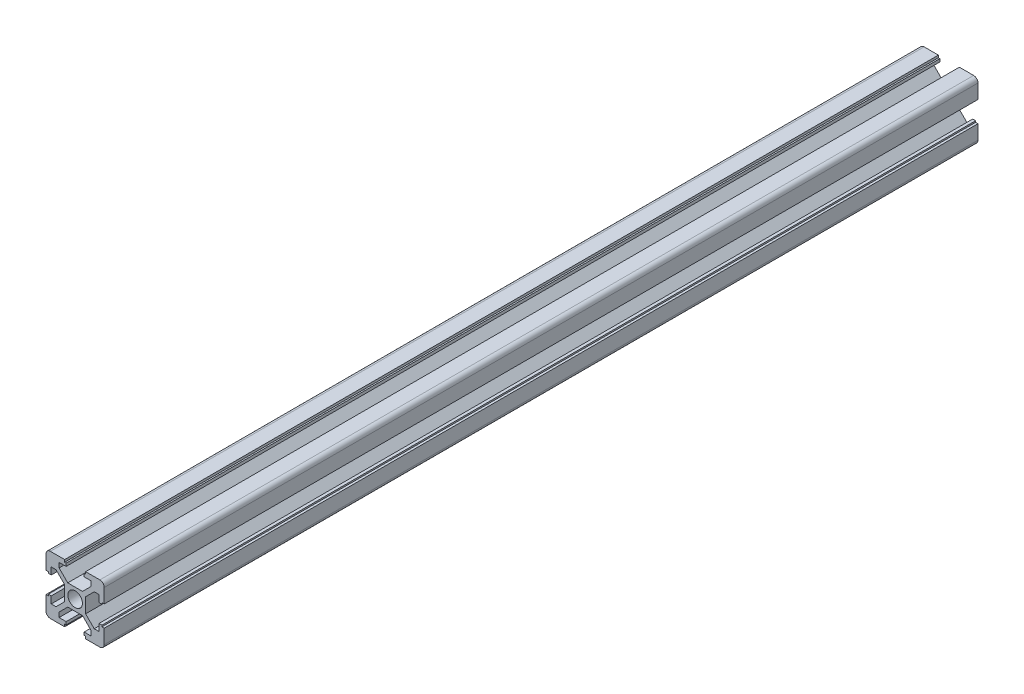
from build123d import *

# Parameters (mm, degrees)
SKETCH_1_R          = 2.5
EXTRUDE_1_DEPTH     = 300
SKETCH_2_R          = 1.75
CUT_EXTRUDE_1_DEPTH = 39


with BuildPart() as part:
    # 草图1 → 凸台-拉伸1 (new body)
    with BuildSketch(Plane.XY):
        with BuildLine():
            Line((-7.376269156, 6.834632883), (-4.415608984, 3.873972711))
            Line((-4.415608984, 3.873972711), (-4.415608984, -1.204706946))
            Line((-4.415608984, -1.204706946), (-7.376269156, -4.165367117))
            Line((-7.376269156, -4.165367117), (-9.015608984, -4.165367117))
            Line((-9.015608984, -4.165367117), (-9.015608984, -1.765367117))
            Line((-9.015608984, -1.765367117), (-10.015608984, -1.765367117))
            Line((-10.015608984, -1.765367117), (-10.015608984, -2.265367117))
            Line((-10.015608984, -2.265367117), (-10.815608984, -2.265367117))
            Line((-10.815608984, -2.265367117), (-10.815608984, -7.165367117))
            ThreePointArc((-10.815608984, -7.165367117), (-10.376269156, -8.226027289), (-9.315608984, -8.665367117))
            Line((-9.315608984, -8.665367117), (-4.415608984, -8.665367117))
            Line((-4.415608984, -8.665367117), (-4.415608984, -7.865367117))
            Line((-4.415608984, -7.865367117), (-3.915608984, -7.865367117))
            Line((-3.915608984, -7.865367117), (-3.915608984, -6.865367117))
            Line((-3.915608984, -6.865367117), (-6.315608984, -6.865367117))
            Line((-6.315608984, -6.865367117), (-6.315608984, -5.226027289))
            Line((-6.315608984, -5.226027289), (-3.354948812, -2.265367117))
            Line((-3.354948812, -2.265367117), (1.723730844, -2.265367117))
            Line((1.723730844, -2.265367117), (4.684391016, -5.226027289))
            Line((4.684391016, -5.226027289), (4.684391016, -6.865367117))
            Line((4.684391016, -6.865367117), (2.284391016, -6.865367117))
            Line((2.284391016, -6.865367117), (2.284391016, -7.865367117))
            Line((2.284391016, -7.865367117), (2.784391016, -7.865367117))
            Line((2.784391016, -7.865367117), (2.784391016, -8.665367117))
            Line((2.784391016, -8.665367117), (7.684391016, -8.665367117))
            ThreePointArc((7.684391016, -8.665367117), (8.745051188, -8.226027289), (9.184391016, -7.165367117))
            Line((9.184391016, -7.165367117), (9.184391016, -2.265367117))
            Line((9.184391016, -2.265367117), (8.384391016, -2.265367117))
            Line((8.384391016, -2.265367117), (8.384391016, -1.765367117))
            Line((8.384391016, -1.765367117), (7.384391016, -1.765367117))
            Line((7.384391016, -1.765367117), (7.384391016, -4.165367117))
            Line((7.384391016, -4.165367117), (5.745051188, -4.165367117))
            Line((5.745051188, -4.165367117), (2.784391016, -1.204706946))
            Line((2.784391016, -1.204706946), (2.784391016, 3.873972711))
            Line((2.784391016, 3.873972711), (5.745051188, 6.834632883))
            Line((5.745051188, 6.834632883), (7.384391016, 6.834632883))
            Line((7.384391016, 6.834632883), (7.384391016, 4.434632883))
            Line((7.384391016, 4.434632883), (8.384391016, 4.434632883))
            Line((8.384391016, 4.434632883), (8.384391016, 4.934632883))
            Line((8.384391016, 4.934632883), (9.184391016, 4.934632883))
            Line((9.184391016, 4.934632883), (9.184391016, 9.834632883))
            ThreePointArc((9.184391016, 9.834632883), (8.745051188, 10.895293054), (7.684391016, 11.334632883))
            Line((7.684391016, 11.334632883), (2.784391016, 11.334632883))
            Line((2.784391016, 11.334632883), (2.784391016, 10.534632883))
            Line((2.784391016, 10.534632883), (2.284391016, 10.534632883))
            Line((2.284391016, 10.534632883), (2.284391016, 9.534632883))
            Line((2.284391016, 9.534632883), (4.684391016, 9.534632883))
            Line((4.684391016, 9.534632883), (4.684391016, 7.895293054))
            Line((4.684391016, 7.895293054), (1.723730844, 4.934632883))
            Line((1.723730844, 4.934632883), (-3.354948812, 4.934632883))
            Line((-3.354948812, 4.934632883), (-6.315608984, 7.895293054))
            Line((-6.315608984, 7.895293054), (-6.315608984, 9.534632883))
            Line((-6.315608984, 9.534632883), (-3.915608984, 9.534632883))
            Line((-3.915608984, 9.534632883), (-3.915608984, 10.534632883))
            Line((-3.915608984, 10.534632883), (-4.415608984, 10.534632883))
            Line((-4.415608984, 10.534632883), (-4.415608984, 11.334632883))
            Line((-4.415608984, 11.334632883), (-9.315608984, 11.334632883))
            ThreePointArc((-9.315608984, 11.334632883), (-10.376269156, 10.895293054), (-10.815608984, 9.834632883))
            Line((-10.815608984, 9.834632883), (-10.815608984, 4.934632883))
            Line((-10.815608984, 4.934632883), (-10.015608984, 4.934632883))
            Line((-10.015608984, 4.934632883), (-10.015608984, 4.434632883))
            Line((-10.015608984, 4.434632883), (-9.015608984, 4.434632883))
            Line((-9.015608984, 4.434632883), (-9.015608984, 6.834632883))
            Line((-9.015608984, 6.834632883), (-7.376269156, 6.834632883))
        make_face()
        with Locations((-0.815608984, 1.334632883)):
            Circle(SKETCH_1_R, mode=Mode.SUBTRACT)
    extrude(amount=EXTRUDE_1_DEPTH)

    # 草图2 → 切除-拉伸1 (cut)
    with BuildSketch(Plane(origin=(2.784391016, 0, 0), x_dir=(0, 0, -1), z_dir=(1, 0, 0))):
        with Locations((-250, 1.334632883)):
            Circle(SKETCH_2_R)
        with Locations((-50, 1.334632883)):
            Circle(SKETCH_2_R)
    extrude(amount=-CUT_EXTRUDE_1_DEPTH, mode=Mode.SUBTRACT)


solid = part.part
